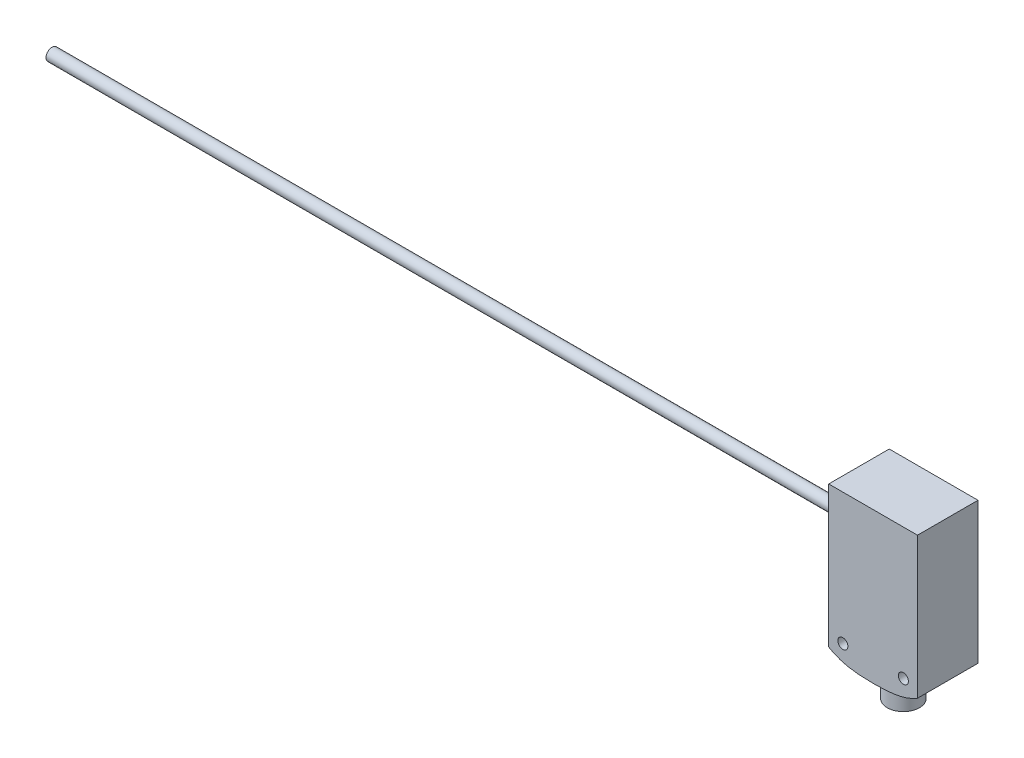
from build123d import *

# Parameters (mm, degrees)
ESQUISSE1_W             = 22
ESQUISSE1_H             = 44.3
ESQUISSE1_R             = 1.25
BOSS_EXTRU_1_DEPTH      = 15
ENL_V_MAT_EXTRU_1_DEPTH = 49.046748069
BOSS_EXTRU_2_REACH      = 50.047
ESQUISSE3_R             = 4
ENL_V_MAT_EXTRU_2_DEPTH = 0.1
ESQUISSE5_R             = 1.5
BOSS_EXTRU_3_DEPTH      = 200


with BuildPart() as part:
    # Esquisse1 → Boss.-Extru.1 (new body)
    with BuildSketch(Plane.XY):
        with Locations((0, 22.15)):
            Rectangle(ESQUISSE1_W, ESQUISSE1_H)
        with Locations((7.5, 11.8)):
            Circle(ESQUISSE1_R, mode=Mode.SUBTRACT)
        with Locations((-7.5, 11.8)):
            Circle(ESQUISSE1_R, mode=Mode.SUBTRACT)
    extrude(amount=BOSS_EXTRU_1_DEPTH)

    # Esquisse2 → Enlèv. mat.-Extru.1 (cut, through all)
    with BuildSketch(Plane.XY.offset(15)):
        with BuildLine():
            Line((-11, 9.3), (-11, 0))
            Line((-11, 0), (11, 0))
            Line((11, 0), (11, 9.3))
            add(Edge.make_bspline(
                [(-11, 9.3), (-7.625374572, 7.236730077), (0, 6.763269923), (7.625374572, 7.236730077), (11, 9.3)],
                knots=[0, 0, 0, 0, 0.5, 1, 1, 1, 1], degree=3))
        make_face()
    extrude(amount=-ENL_V_MAT_EXTRU_1_DEPTH, mode=Mode.SUBTRACT)

    # Esquisse3 → Boss.-Extru.2 (add, up to next)
    with BuildSketch(Plane(origin=(0, 0, 0), x_dir=(1, 0, 0), z_dir=(0, 1, 0)), mode=Mode.PRIVATE) as boss_extru_2_sk1:
        with Locations((0, -7.5)):
            Circle(ESQUISSE3_R)
    boss_extru_2_tool1 = extrude(boss_extru_2_sk1.sketch, amount=BOSS_EXTRU_2_REACH, mode=Mode.PRIVATE) - part.part
    add(boss_extru_2_tool1.solids().sort_by_distance((0, 0, 7.5))[0])

    # Esquisse4 → Enlèv. mat.-Extru.2 (cut)
    with BuildSketch(Plane.ZY.offset(11)):
        with BuildLine():
            Line((1.3, 37.8), (13.7, 37.8))
            Line((13.7, 37.8), (13.7, 16.8))
            ThreePointArc((13.7, 16.8), (7.5, 15.814731131), (1.3, 16.8))
            Line((1.3, 16.8), (1.3, 37.8))
        make_face()
    extrude(amount=-ENL_V_MAT_EXTRU_2_DEPTH, mode=Mode.SUBTRACT)


with BuildPart() as body_2:
    # Esquisse5 → Boss.-Extru.3 (new body)
    with BuildSketch(Plane.ZY.offset(11)):
        with Locations((7.5, 32.8)):
            Circle(ESQUISSE5_R)
    extrude(amount=BOSS_EXTRU_3_DEPTH)


solid = Compound([part.part, body_2.part])
